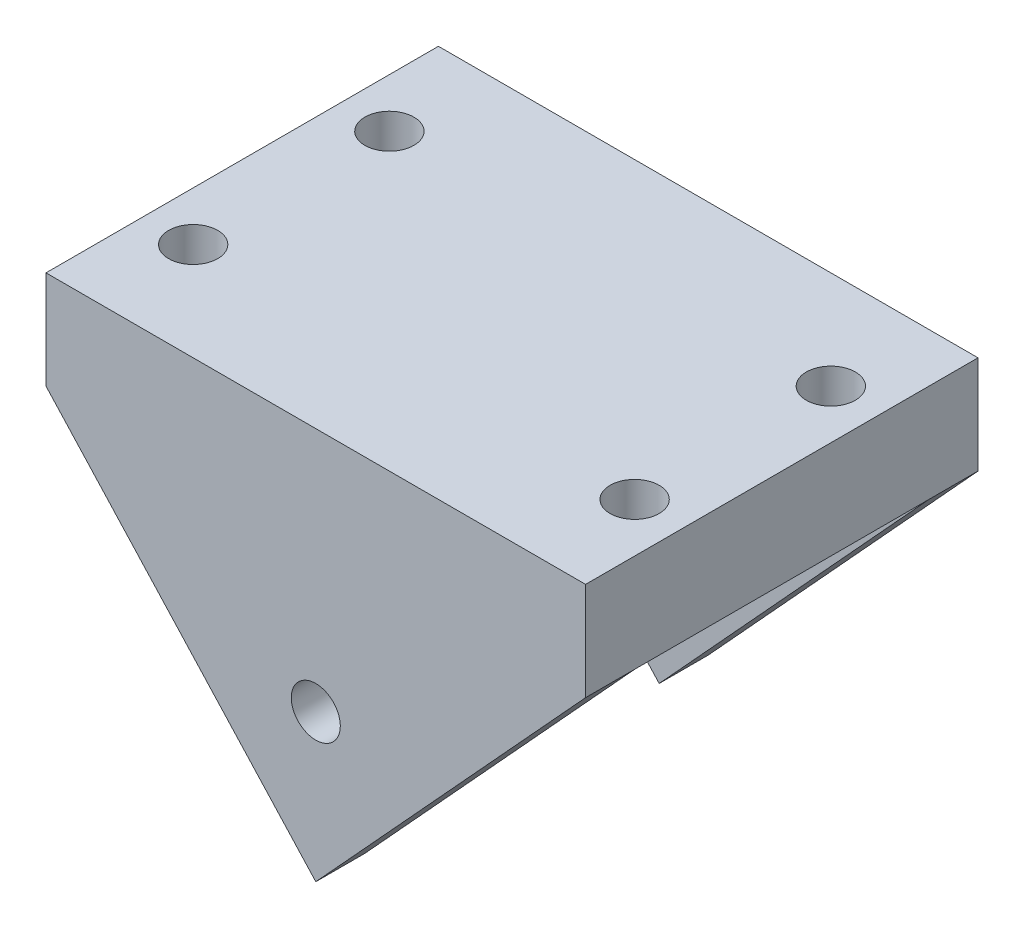
from build123d import *

# Parameters (mm, degrees)
SKETCH1_W           = 110
SKETCH1_H           = 60
BOSS_EXTRUDE1_DEPTH = 20
SKETCH3_R           = 5
CUT_EXTRUDE1_DEPTH  = 10
BOSS_EXTRUDE2_DEPTH = 10
SKETCH5_R           = 5
CUT_EXTRUDE2_DEPTH  = 115.127122105


with BuildPart() as part:
    # Sketch1 → Boss-Extrude1 (new body)
    with BuildSketch(Plane(origin=(0, 0, 0), x_dir=(1, 0, 0), z_dir=(0, 1, 0))):
        Rectangle(SKETCH1_W, SKETCH1_H)
    extrude(amount=BOSS_EXTRUDE1_DEPTH)

    # Sketch3 → Cut-Extrude1 (cut)
    with BuildSketch(Plane(origin=(0, 20, 0), x_dir=(1, 0, 0), z_dir=(0, 1, 0))):
        with Locations((-45, 20)):
            Circle(SKETCH3_R)
        with Locations((45, 20)):
            Circle(SKETCH3_R)
        with Locations((45, -20)):
            Circle(SKETCH3_R)
        with Locations((-45, -20)):
            Circle(SKETCH3_R)
    extrude(amount=-CUT_EXTRUDE1_DEPTH, mode=Mode.SUBTRACT)

    # Sketch4 → Boss-Extrude2 (add)
    with BuildSketch(Plane.XY.offset(30)):
        Polygon((-55, 0), (0, -60), (55, 0), (55, 20), (-55, 20), align=None)
    boss_extrude2 = extrude(amount=BOSS_EXTRUDE2_DEPTH)

    # Mirror1: Boss-Extrude2 across plane
    add(boss_extrude2.mirror(Plane.XY))

    # Sketch5 → Cut-Extrude2 (cut, through all)
    with BuildSketch(Plane.XY.offset(40)):
        with Locations((0, -30)):
            Circle(SKETCH5_R)
    extrude(amount=-CUT_EXTRUDE2_DEPTH, mode=Mode.SUBTRACT)


solid = part.part
